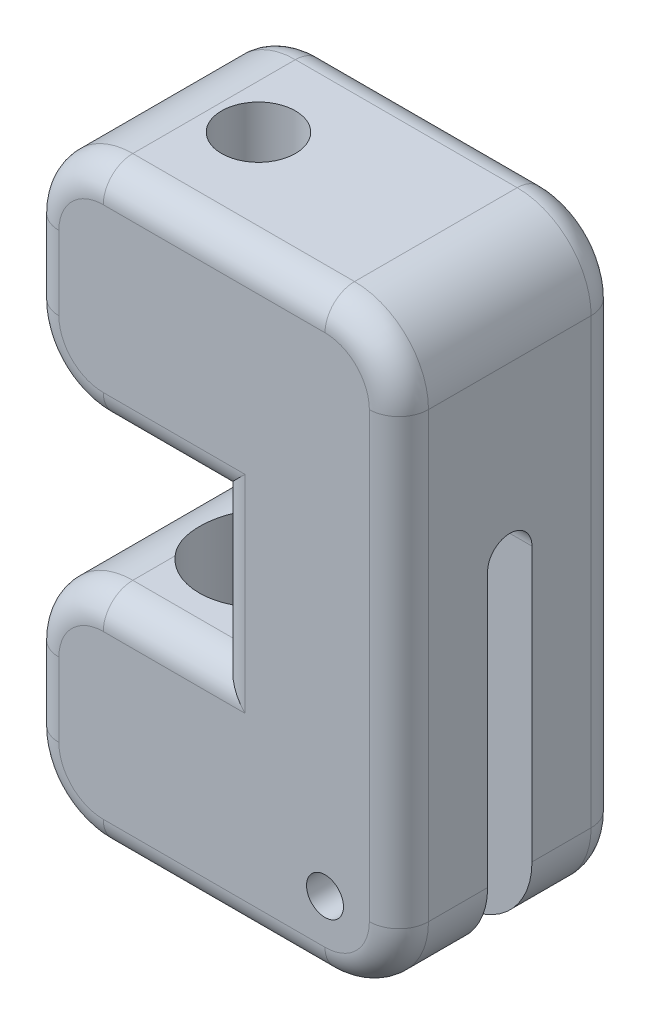
from build123d import *

# Parameters (mm, degrees)
SKIZZE1_W                       = 25
SKIZZE1_H                       = 15
SKIZZE1_R                       = 4
AUFSATZ_LINEAR_AUSTRAGEN1_DEPTH = 40
SCHNITT_LINEAR_START            = -15
SCHNITT_LINEAR_AUSTRAGEN1_DEPTH = 71
M3_GEWINDEBOHRUNG1_D            = 2.5
VERRUNDUNG2_R                   = 2
SKIZZE5_W                       = 17.099513742
SKIZZE5_H                       = 10
SCHNITT_LINEAR_AUSTRAGEN2_DEPTH = 13
AUFSATZ_LINEAR_START            = -15
SKIZZE6_R                       = 4
SKIZZE6_R_2                     = 2.5
AUFSATZ_LINEAR_AUSTRAGEN2_DEPTH = 15
VERRUNDUNG5_R                   = 5
VERRUNDUNG6_R                   = 2
VERRUNDUNG7_R                   = 1.5


# Some blends are built 0.0001 mm under size
with BuildPart() as part:
    # Skizze1 → Aufsatz-Linear austragen1 (new body)
    with BuildSketch(Plane(origin=(0, 0, 0), x_dir=(1, 0, 0), z_dir=(0, 1, 0))):
        with Locations((4.5, 0)):
            Rectangle(SKIZZE1_W, SKIZZE1_H)
        with Locations(Location((0, 0, 0), (0, 0, 270))):
            Circle(SKIZZE1_R, mode=Mode.SUBTRACT)
    extrude(amount=AUFSATZ_LINEAR_AUSTRAGEN1_DEPTH)

    # Skizze2 → Schnitt-Linear austragen1 (cut)
    with BuildSketch(Plane(origin=(0, 40, 0), x_dir=(1, 0, 0), z_dir=(0, 1, 0)).offset(SCHNITT_LINEAR_START)):
        with BuildLine():
            Line((0, 1.5), (23.752899364, 1.5))
            ThreePointArc((23.752899364, 1.5), (25.252899364, 0), (23.752899364, -1.5))
            Line((23.752899364, -1.5), (0, -1.5))
            ThreePointArc((0, -1.5), (-1.5, 0), (0, 1.5))
        make_face()
    extrude(amount=-SCHNITT_LINEAR_AUSTRAGEN1_DEPTH, mode=Mode.SUBTRACT)

    # M3 Gewindebohrung1 (through all)
    with Locations(Plane.XY.offset(7.5)):
        with Locations((12, 5)):
            Hole(M3_GEWINDEBOHRUNG1_D / 2)

    # Verrundung2
    verrundung2_edges = [part.edges().sort_by_distance(p)[0] for p in [
        (3.708099244, 12.5, 1.5),
        (3.708099244, 12.5, -1.5),
    ]]
    fillet(verrundung2_edges, radius=VERRUNDUNG2_R)

    # Skizze5 → Schnitt-Linear austragen2 (cut, symmetric)
    with BuildSketch(Plane.XY):
        with Locations((-3.960992506, 20)):
            Rectangle(SKIZZE5_W, SKIZZE5_H)
    extrude(amount=SCHNITT_LINEAR_AUSTRAGEN2_DEPTH, both=True, mode=Mode.SUBTRACT)

    # Skizze6 → Aufsatz-Linear austragen2 (add)
    with BuildSketch(Plane(origin=(0, 40, 0), x_dir=(1, 0, 0), z_dir=(0, 1, 0)).offset(AUFSATZ_LINEAR_START)):
        Circle(SKIZZE6_R)
        with Locations(Location((0, 0, 0), (0, 0, 270))):
            Circle(SKIZZE6_R_2, mode=Mode.SUBTRACT)
    extrude(amount=AUFSATZ_LINEAR_AUSTRAGEN2_DEPTH)

    # Verrundung5
    # the kernel refuses this fillet: 5 mm, written as the material it takes off along each edge
    with BuildSketch(Plane(origin=(17, 40, -20), x_dir=(0, -1, 0), z_dir=(0, 0, 1)), Plane(origin=(-8, 0, 20), x_dir=(1, 0, 0), z_dir=(0, 0, -1)), Plane(origin=(-8, 15, 20), x_dir=(0, -1, 0), z_dir=(0, 0, -1))) as verrundung5_piece_1:
        with BuildLine():
            CenterArc((VERRUNDUNG5_R, -VERRUNDUNG5_R), VERRUNDUNG5_R, 90, 90)
            Line((0, -VERRUNDUNG5_R), (0, 0))
            Line((0, 0), (VERRUNDUNG5_R, 0))
        make_face()
    extrude(amount=40, mode=Mode.SUBTRACT)
    with BuildSketch(Plane(origin=(17, 0, -20), x_dir=(-1, 0, 0), z_dir=(0, 0, 1)), Plane(origin=(17, 0, -11), x_dir=(-1, 0, 0), z_dir=(0, 0, 1))) as verrundung5_piece_2:
        with BuildLine():
            CenterArc((VERRUNDUNG5_R, -VERRUNDUNG5_R), VERRUNDUNG5_R, 90, 90)
            Line((0, -VERRUNDUNG5_R), (0, 0))
            Line((0, 0), (VERRUNDUNG5_R, 0))
        make_face()
    extrude(amount=31, mode=Mode.SUBTRACT)
    with BuildSketch(Plane(origin=(-8, 40, 20), x_dir=(1, 0, 0), z_dir=(0, 0, -1)), Plane(origin=(-8, 25, -20), x_dir=(1, 0, 0), z_dir=(0, 0, 1))) as verrundung5_piece_3:
        with BuildLine():
            CenterArc((VERRUNDUNG5_R, VERRUNDUNG5_R), VERRUNDUNG5_R, 180, 90)
            Line((0, VERRUNDUNG5_R), (0, 0))
            Line((0, 0), (VERRUNDUNG5_R, 0))
        make_face()
    extrude(amount=40, mode=Mode.SUBTRACT)

    # Verrundung6
    verrundung6_edges = [part.edges().sort_by_distance(p)[0] for p in [
        (-8, 7.5, 7.5),
        (-8, 7.5, -7.5),
        (-8, 32.5, 7.5),
        (0.794382183, 25, 7.5),
        (4.5, 0, 7.5),
        (17, 20, 7.5),
        (4.5, 40, 7.5),
        (15.535533906, 1.464466094, 7.5),
        (15.535533906, 38.535533906, 7.5),
        (-6.535533906, 38.535533906, 7.5),
        (-6.535533906, 26.464466094, 7.5),
        (-6.535533906, 13.535533906, 7.5),
        (-6.535533906, 1.464466094, 7.5),
        (4.5, 0, -7.5),
        (-8, 32.5, -7.5),
        (4.5, 40, -7.5),
        (17, 20, -7.5),
        (0.794382183, 15, -7.5),
        (15.535533906, 1.464466094, -7.5),
        (15.535533906, 38.535533906, -7.5),
        (-6.535533906, 38.535533906, -7.5),
        (-6.535533906, 26.464466094, -7.5),
        (-6.535533906, 13.535533906, -7.5),
        (-6.535533906, 1.464466094, -7.5),
        (0.794382183, 25, -7.5),
        (4.588764365, 20, 7.5),
        (4.588764365, 20, -7.5),
        (0.794382183, 15, 7.5),
    ]]
    fillet(verrundung6_edges, radius=VERRUNDUNG6_R)

    # Verrundung7
    verrundung7_edges = [part.edges().sort_by_distance(p)[0] for p in [
        (4.730717229, 25, 1.505095884),
        (4.730717229, 25, -1.505095884),
        (10.936698586, 25, 1.5),
        (10.936698586, 25, -1.5),
    ]]
    fillet(verrundung7_edges, radius=VERRUNDUNG7_R - 0.0001)  # a hair under: the kernel refuses the full size


solid = part.part
